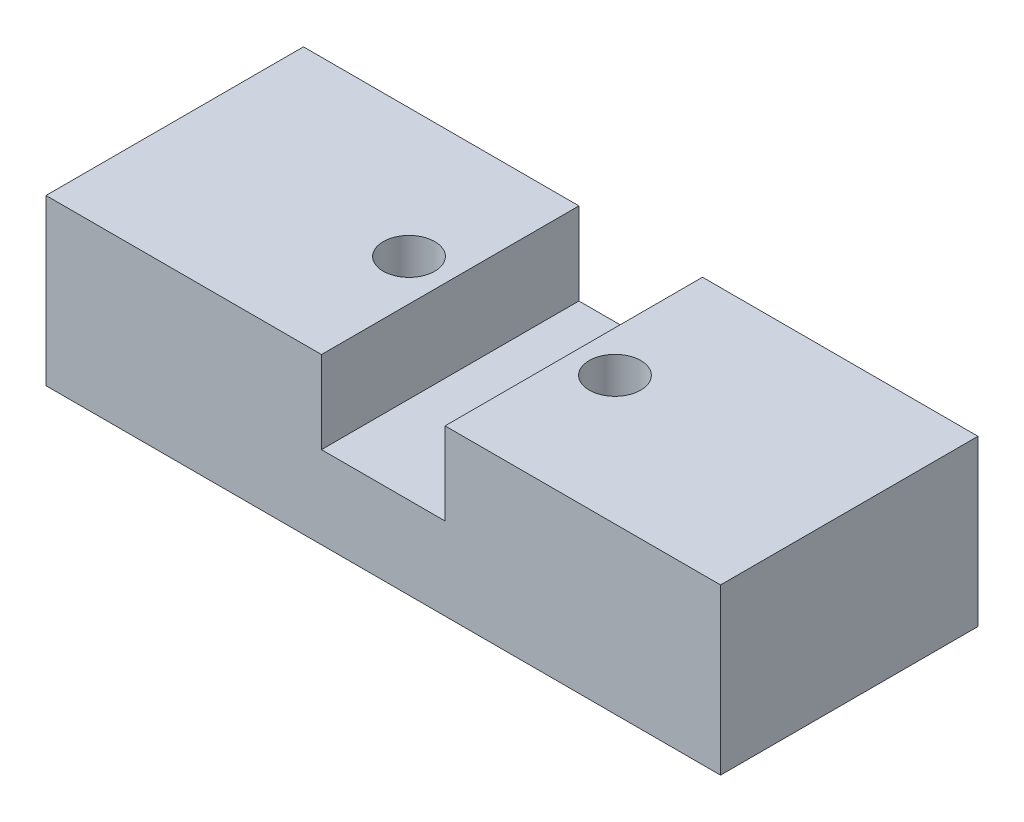
from build123d import *

# Parameters (mm, degrees)
BOSS_EXTRUDE1_DEPTH   = 25
F_5_0MM_DOWEL_HOLE1_D = 5


with BuildPart() as part:
    # Sketch1 → Boss-Extrude1 (new body)
    with BuildSketch(Plane.XY):
        Polygon((26.75, 16), (26.75, 8), (38.75, 8), (38.75, 16), (65.5, 16), (65.5, 0), (0, 0), (0, 16), align=None)
    extrude(amount=BOSS_EXTRUDE1_DEPTH)

    # Ø5.0mm Dowel Hole1 (through all)
    with Locations(Plane(origin=(0, 16, 0), x_dir=(1, 0, 0), z_dir=(0, 1, 0))):
        with Locations((22.75, -12.5), (42.75, -12.5)):
            Hole(F_5_0MM_DOWEL_HOLE1_D / 2)


solid = part.part
